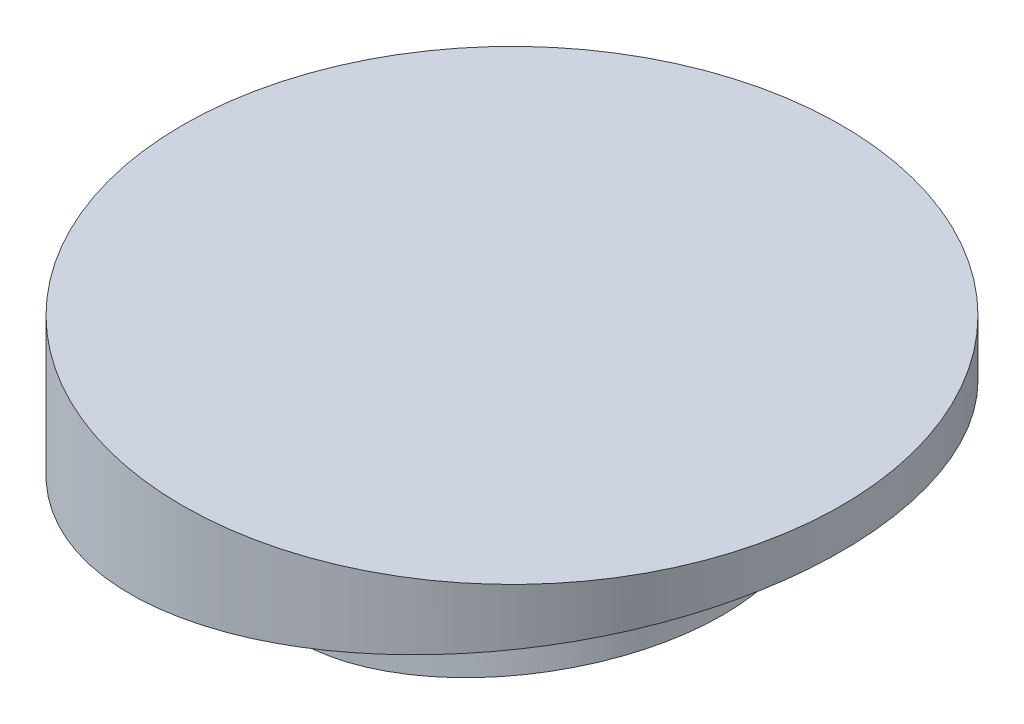
from build123d import *

# Parameters (mm, degrees)
SKETCH_5_R          = 25
EXTRUDE_4_DEPTH     = 20
CUT_EXTRUDE_2_DEPTH = 41
SKETCH_8_R          = 15
EXTRUDE_5_DEPTH     = 7


with BuildPart() as part:
    # 草图5 → 凸台-拉伸4 (new body)
    with BuildSketch(Plane(origin=(0, 0, 0), x_dir=(1, 0, 0), z_dir=(0, 1, 0))):
        Circle(SKETCH_5_R)
    extrude(amount=EXTRUDE_4_DEPTH)

    # 草图7 → 切除-拉伸2 (cut, symmetric)
    with BuildSketch(Plane.XY):
        Polygon((-25, 8.183650965), (25, 17), (25, -9.727272727), (-25, -9.727272727), align=None)
    extrude(amount=CUT_EXTRUDE_2_DEPTH, both=True, mode=Mode.SUBTRACT)

    # 草图8 → 凸台-拉伸5 (add)
    with BuildSketch(Plane(origin=(-2.153328978, 12.212135485, 0), x_dir=(0.9848077530122079, 0.17364817766693127, 0), z_dir=(0.17364817766693127, -0.9848077530122079, 0))):
        with Locations((2.186547548, 0)):
            Circle(SKETCH_8_R)
    extrude(amount=EXTRUDE_5_DEPTH)


solid = part.part
